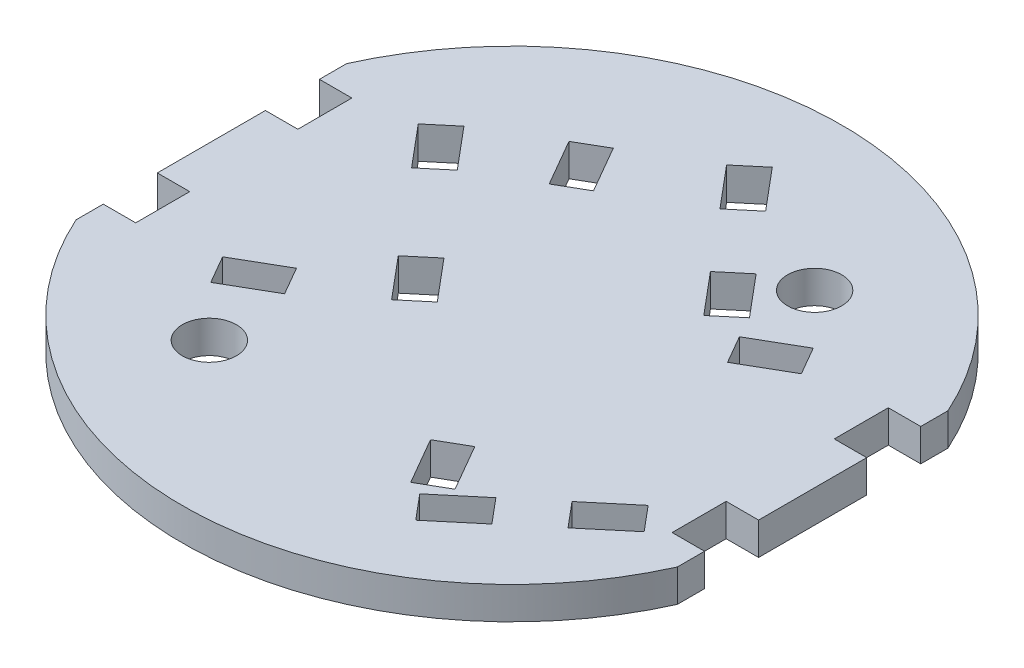
from build123d import *

# Parameters (mm, degrees)
CROQUIS1_R              = 30.5
SALIENTE_EXTRUIR1_DEPTH = 3
CORTAR_EXTRUIR3_START   = -4
CORTAR_EXTRUIR3_DEPTH   = 4
CORTAR_EXTRUIR6_DEPTH   = 10
CROQUIS10_R             = 2.5
CORTAR_EXTRUIR7_DEPTH   = 10
CORTAR_EXTRUIR8_START   = -3
CORTAR_EXTRUIR8_DEPTH   = 3
CORTAR_EXTRUIR9_DEPTH   = 10


with BuildPart() as part:
    # Croquis1 → Saliente-Extruir1 (new body)
    with BuildSketch(Plane(origin=(0, 0, 0), x_dir=(1, 0, 0), z_dir=(0, 1, 0))):
        Circle(CROQUIS1_R)
    extrude(amount=SALIENTE_EXTRUIR1_DEPTH)

    # Croquis5 → Cortar-Extruir3 (cut)
    with BuildSketch(Plane(origin=(0, 3, 0), x_dir=(1, 0, 0), z_dir=(0, 1, 0)).offset(CORTAR_EXTRUIR3_START)):
        with BuildLine():
            Line((30.087372767, -5), (24.814059068, -5))
            Line((24.814059068, -5), (24.814059068, -10))
            Line((24.814059068, -10), (28.814059068, -10))
            ThreePointArc((28.814059068, -10), (29.556634924, -7.526973624), (30.087372767, -5))
        make_face()
        with BuildLine():
            Line((24.814059068, 5), (30.087372767, 5))
            ThreePointArc((30.087372767, 5), (29.556634924, 7.526973624), (28.814059068, 10))
            Line((28.814059068, 10), (24.814059068, 10))
            Line((24.814059068, 10), (24.814059068, 5))
        make_face()
        with BuildLine():
            ThreePointArc((-30.087372767, -5), (-29.556634924, -7.526973624), (-28.814059068, -10))
            Line((-28.814059068, -10), (-24.814059068, -10))
            Line((-24.814059068, -10), (-24.814059068, -5))
            Line((-24.814059068, -5), (-30.087372767, -5))
        make_face()
        with BuildLine():
            Line((-24.814059068, 10), (-28.814059068, 10))
            ThreePointArc((-28.814059068, 10), (-29.556634924, 7.526973624), (-30.087372767, 5))
            Line((-30.087372767, 5), (-24.814059068, 5))
            Line((-24.814059068, 5), (-24.814059068, 10))
        make_face()
    extrude(amount=CORTAR_EXTRUIR3_DEPTH, mode=Mode.SUBTRACT)

    # Croquis9 → Cortar-Extruir6 (cut)
    with BuildSketch(Plane(origin=(0, 3, 0), x_dir=(1, 0, 0), z_dir=(0, 1, 0))):
        Polygon((7.971418181, 14.613753061), (5.673284852, 12.685390231), (8.887222901, 8.855168016), (11.18535623, 10.783530845), align=None)
        Polygon((-4.518554854, -2.393615154), (-7.732492903, 1.436607062), (-10.030626232, -0.491755767), (-6.816688183, -4.321977983), align=None)
        Polygon((23.455638465, -11.229310268), (21.527275636, -8.931176939), (17.69705342, -12.145114987), (19.625416249, -14.443248317), align=None)
        Polygon((0.177618414, 23.902041933), (-2.120514915, 21.973679104), (1.093423133, 18.143456889), (3.391556462, 20.071819718), align=None)
        Polygon((-16.458502329, 7.168688664), (-14.160368999, 9.097051493), (-17.374307048, 12.927273709), (-19.672440377, 10.99891088), align=None)
        Polygon((15.795194034, -17.657186365), (13.866831205, -15.359053036), (10.036608989, -18.572991084), (11.964971818, -20.871124414), align=None)
    extrude(amount=-CORTAR_EXTRUIR6_DEPTH, mode=Mode.SUBTRACT)

    # Croquis10 → Cortar-Extruir7 (cut)
    with BuildSketch(Plane(origin=(0, 3, 0), x_dir=(1, 0, 0), z_dir=(0, 1, 0))):
        with Locations((12, 16)):
            Circle(CROQUIS10_R)
        with Locations((-12, -16)):
            Circle(CROQUIS10_R)
    extrude(amount=-CORTAR_EXTRUIR7_DEPTH, mode=Mode.SUBTRACT)

    # Croquis11 → Cortar-Extruir8 (cut)
    with BuildSketch(Plane(origin=(0, 3, 0), x_dir=(1, 0, 0), z_dir=(0, 1, 0)).offset(CORTAR_EXTRUIR8_START)):
        with BuildLine():
            Line((30.087372767, 5), (27.814059068, 5))
            Line((27.814059068, 5), (27.814059068, -5))
            Line((27.814059068, -5), (30.087372767, -5))
            ThreePointArc((30.087372767, -5), (30.5, 0), (30.087372767, 5))
        make_face()
        with BuildLine():
            Line((-27.814059068, -5), (-27.814059068, 5))
            Line((-27.814059068, 5), (-30.087372767, 5))
            ThreePointArc((-30.087372767, 5), (-30.5, 0), (-30.087372767, -5))
            Line((-30.087372767, -5), (-27.814059068, -5))
        make_face()
        with BuildLine():
            Line((27.814059068, 12.515115586), (27.814059068, 10))
            Line((27.814059068, 10), (28.814059068, 10))
            ThreePointArc((28.814059068, 10), (28.341972277, 11.268655974), (27.814059068, 12.515115586))
        make_face()
        with BuildLine():
            Line((-27.814059068, 10), (-27.814059068, 12.515115586))
            ThreePointArc((-27.814059068, 12.515115586), (-28.341972277, 11.268655974), (-28.814059068, 10))
            Line((-28.814059068, 10), (-27.814059068, 10))
        make_face()
        with BuildLine():
            ThreePointArc((-28.814059068, -10), (-28.341972277, -11.268655974), (-27.814059068, -12.515115586))
            Line((-27.814059068, -12.515115586), (-27.814059068, -10))
            Line((-27.814059068, -10), (-28.814059068, -10))
        make_face()
        with BuildLine():
            Line((28.814059068, -10), (27.814059068, -10))
            Line((27.814059068, -10), (27.814059068, -12.515115586))
            ThreePointArc((27.814059068, -12.515115586), (28.341972277, -11.268655974), (28.814059068, -10))
        make_face()
    extrude(amount=CORTAR_EXTRUIR8_DEPTH, mode=Mode.SUBTRACT)

    # Croquis12 → Cortar-Extruir9 (cut)
    with BuildSketch(Plane(origin=(0, 3, 0), x_dir=(1, 0, 0), z_dir=(0, 1, 0))):
        Polygon((13.740381057, 6.200961894), (18.070508076, 8.700961894), (16.570508076, 11.299038106), (12.240381057, 8.799038106), align=None)
        Polygon((11.299038106, -16.570508076), (8.799038106, -12.240381057), (6.200961894, -13.740381057), (8.700961894, -18.070508076), align=None)
        Polygon((-16.570508076, -11.299038106), (-12.240381057, -8.799038106), (-13.740381057, -6.200961894), (-18.070508076, -8.700961894), align=None)
        Polygon((-8.799038106, 12.240381057), (-6.200961894, 13.740381057), (-8.700961894, 18.070508076), (-11.299038106, 16.570508076), align=None)
    extrude(amount=-CORTAR_EXTRUIR9_DEPTH, mode=Mode.SUBTRACT)


solid = part.part
